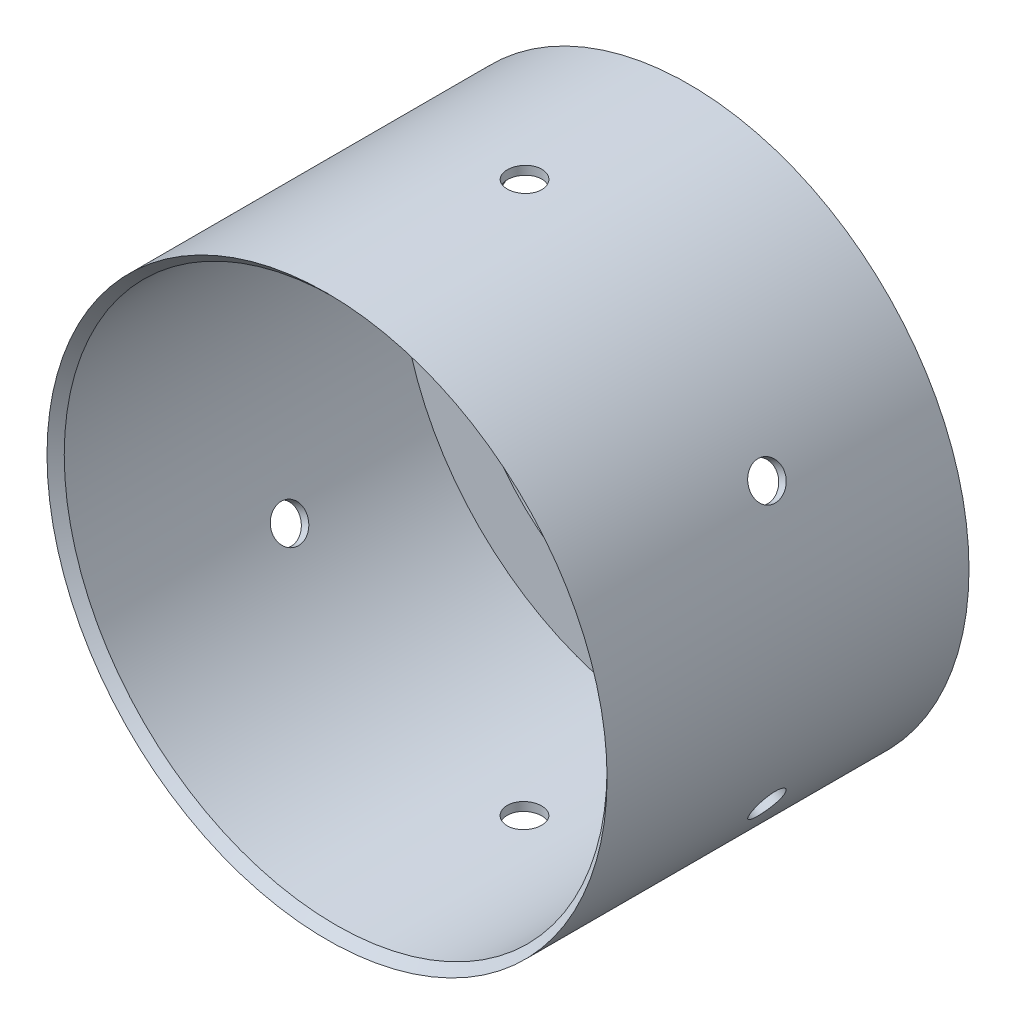
from build123d import *

# Parameters (mm, degrees)
SKETCH1_R               = 32.5
SKETCH1_R_2             = 31.5
EXTRUDE_THIN1_DEPTH     = 40
SKETCH2_R               = 2
CUT_EXTRUDE1_DEPTH      = 61.930288035
CIRPATTERN1_START       = -32.500000066
CIRPATTERN1_OUTLINE_R   = 2
CIRPATTERN1_DEPTH       = 65.000000132
CIRPATTERN1_2_OUTLINE_R = 2
CIRPATTERN1_2_DEPTH     = 65.000000132
EXTRUDE_THIN2_START     = 2
SKETCH3_R               = 32.5
SKETCH3_R_2             = 24.5
EXTRUDE_THIN2_DEPTH     = 2
CHAMFER1_SIZE           = 1


# Read off the part's stored shape, not the designer's step: CirPattern1
with BuildPart() as part:
    # Sketch1 → Extrude-Thin1 (new body)
    with BuildSketch(Plane(origin=(0, 0, 0), x_dir=(0, 1, 0), z_dir=(0, 0, 1))):
        Circle(SKETCH1_R)
        Circle(SKETCH1_R_2, mode=Mode.SUBTRACT)
    extrude(amount=EXTRUDE_THIN1_DEPTH)

    # Sketch2 → Cut-Extrude1 (cut, symmetric)
    with BuildSketch(Plane(origin=(0, 0, 0), x_dir=(-1, 0, 0), z_dir=(0, 1, 0))):
        with Locations(Location((0, 17.085, 0), (0, 0, 90))):
            Circle(SKETCH2_R)
    extrude(amount=CUT_EXTRUDE1_DEPTH, both=True, mode=Mode.SUBTRACT)

    # CirPattern1 outline → CirPattern1 (cut)
    with BuildSketch(Plane(origin=(0, 0, 0), x_dir=(0.500000000000004, -0.8660254037844363, 0), z_dir=(0.8660254037844363, 0.5000000000000042, 0)).offset(CIRPATTERN1_START)):
        with Locations((0, -17.085)):
            Circle(CIRPATTERN1_OUTLINE_R)
    extrude(amount=CIRPATTERN1_DEPTH, mode=Mode.SUBTRACT)

    # CirPattern1 2 outline → CirPattern1 2 (cut)
    with BuildSketch(Plane(origin=(0, 0, 0), x_dir=(0.49999999999999767, 0.86602540378444, 0), z_dir=(0.8660254037844399, -0.49999999999999795, 0)).offset(CIRPATTERN1_START)):
        with Locations((0, 17.085)):
            Circle(CIRPATTERN1_2_OUTLINE_R)
    extrude(amount=CIRPATTERN1_2_DEPTH, mode=Mode.SUBTRACT)

    # Sketch3 → Extrude-Thin2 (add)
    with BuildSketch(Plane(origin=(0, 0, 0), x_dir=(1, 0, 0), z_dir=(0, 0, -1)).offset(EXTRUDE_THIN2_START)):
        Circle(SKETCH3_R)
        Circle(SKETCH3_R_2, mode=Mode.SUBTRACT)
    extrude(amount=-EXTRUDE_THIN2_DEPTH)

    # Chamfer1
    chamfer1_edges = [part.edges().sort_by_distance(p)[0] for p in [
        (0, -31.5, 40),
    ]]
    chamfer(chamfer1_edges, length=CHAMFER1_SIZE - 0.0001)  # a hair under: the kernel refuses the full size


solid = part.part
